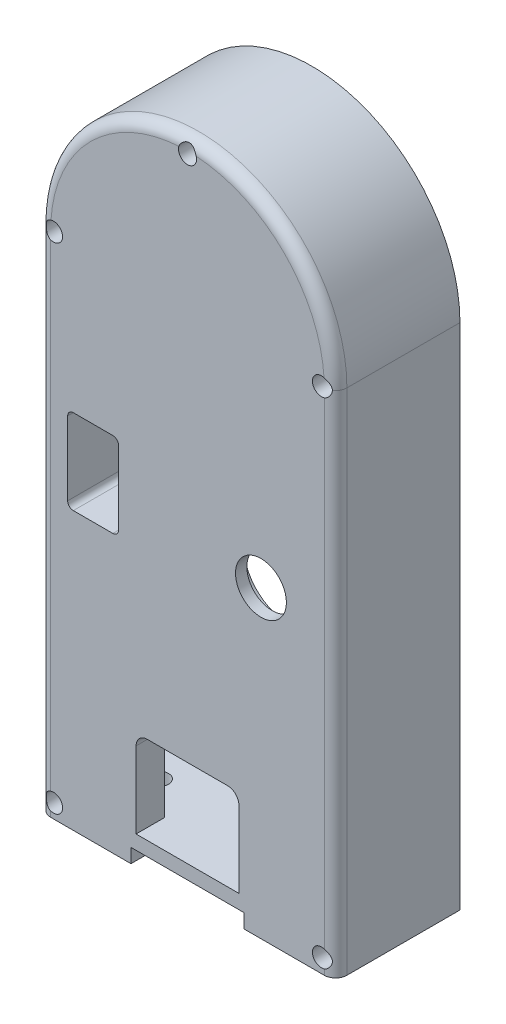
from build123d import *

# Parameters (mm, degrees)
SKETCH1_R               = 1.6
BOSS_EXTRUDE1_DEPTH     = 17
SKETCH2_R               = 1.65
CUT_EXTRUDE1_DEPTH      = 18
BOSS_EXTRUDE2_OUTLINE_R = 1.6
BOSS_EXTRUDE2_OUTLINE_W = 18.2
BOSS_EXTRUDE2_OUTLINE_H = 15.5
BOSS_EXTRUDE2_DEPTH     = 5
SKETCH5_R               = 8.1
CUT_EXTRUDE2_DEPTH      = 3
SKETCH6_R               = 4.5
CUT_EXTRUDE3_DEPTH      = 96.845918014
BOSS_EXTRUDE4_DEPTH     = 14
BOSS_EXTRUDE5_DEPTH     = 3
FILLET1_R               = 2
SKETCH10_W              = 9
SKETCH10_H              = 15
CUT_EXTRUDE4_DEPTH      = 5
FILLET2_R               = 1
FILLET3_R               = 1
FILLET4_R               = 2


# Read off the part's stored shape, not the designer's step: Boss-Extrude2
with BuildPart() as part:
    # Sketch1 → Boss-Extrude1 (new body)
    with BuildSketch(Plane.XY):
        with BuildLine():
            Line((10, -87.5), (10, -90))
            Line((10, -90), (26.2, -90))
            Line((26.2, -90), (26.2, 0))
            ThreePointArc((26.2, 0), (0, 26.2), (-26.2, 0))
            Line((-26.2, 0), (-26.2, -90))
            Line((-26.2, -90), (-10, -90))
            Line((-10, -90), (-10, -87.5))
            Line((-10, -87.5), (10, -87.5))
        make_face()
        with Locations((-23.7, -87.5)):
            Circle(SKETCH1_R, mode=Mode.SUBTRACT)
        with Locations((23.7, -87.5)):
            Circle(SKETCH1_R, mode=Mode.SUBTRACT)
        with Locations((-23.7, 0)):
            Circle(SKETCH1_R, mode=Mode.SUBTRACT)
        with Locations((0, 23.7)):
            Circle(SKETCH1_R, mode=Mode.SUBTRACT)
        with Locations((23.7, 0)):
            Circle(SKETCH1_R, mode=Mode.SUBTRACT)
        with BuildLine():
            Line((-21.2, -85), (21.2, -85))
            Line((21.2, -85), (21.2, 0))
            ThreePointArc((21.2, 0), (0, 21.2), (-21.2, 0))
            Line((-21.2, 0), (-21.2, -85))
        make_face(mode=Mode.SUBTRACT)
    extrude(amount=BOSS_EXTRUDE1_DEPTH)

    # Sketch2 → Cut-Extrude1 (cut)
    with BuildSketch(Plane.XZ.offset(90)):
        with Locations((15.5, 11.5)):
            Circle(SKETCH2_R)
        with Locations((-15.5, 11.5)):
            Circle(SKETCH2_R)
    extrude(amount=-CUT_EXTRUDE1_DEPTH, mode=Mode.SUBTRACT)

    # Boss-Extrude2 outline → Boss-Extrude2 (add)
    with BuildSketch(Plane.XY.offset(17)):
        with BuildLine():
            Line((-10, -87.5), (10, -87.5))
            Line((10, -87.5), (10, -90))
            Line((10, -90), (26.2, -90))
            Line((26.2, -90), (26.2, 0))
            ThreePointArc((26.2, 0), (0, 26.2), (-26.2, 0))
            Line((-26.2, 0), (-26.2, -90))
            Line((-26.2, -90), (-10, -90))
            Line((-10, -90), (-10, -87.5))
        make_face()
        with Locations((-23.7, -87.5)):
            Circle(BOSS_EXTRUDE2_OUTLINE_R, mode=Mode.SUBTRACT)
        with Locations((0, -77.25)):
            Rectangle(BOSS_EXTRUDE2_OUTLINE_W, BOSS_EXTRUDE2_OUTLINE_H, mode=Mode.SUBTRACT)
        with Locations((23.7, -87.5)):
            Circle(BOSS_EXTRUDE2_OUTLINE_R, mode=Mode.SUBTRACT)
        with Locations((-23.7, 0)):
            Circle(BOSS_EXTRUDE2_OUTLINE_R, mode=Mode.SUBTRACT)
        with Locations((0, 23.7)):
            Circle(BOSS_EXTRUDE2_OUTLINE_R, mode=Mode.SUBTRACT)
        with Locations((23.7, 0)):
            Circle(BOSS_EXTRUDE2_OUTLINE_R, mode=Mode.SUBTRACT)
    extrude(amount=BOSS_EXTRUDE2_DEPTH)

    # Sketch5 → Cut-Extrude2 (cut)
    with BuildSketch(Plane(origin=(0, 0, 17), x_dir=(-1, 0, 0), z_dir=(0, 0, -1))):
        with Locations((-12.995105527, -36.242762456)):
            Circle(SKETCH5_R)
    extrude(amount=-CUT_EXTRUDE2_DEPTH, mode=Mode.SUBTRACT)

    # Sketch6 → Cut-Extrude3 (cut, through all)
    with BuildSketch(Plane(origin=(0, 0, 20), x_dir=(-1, 0, 0), z_dir=(0, 0, -1))):
        with Locations((-12.995105527, -36.242762456)):
            Circle(SKETCH6_R)
    extrude(amount=-CUT_EXTRUDE3_DEPTH, mode=Mode.SUBTRACT)

    # Sketch7 → Boss-Extrude4 (add)
    with BuildSketch(Plane(origin=(0, 0, 17), x_dir=(-1, 0, 0), z_dir=(0, 0, -1))):
        with BuildLine():
            Line((21.2, -41), (13.2, -41))
            ThreePointArc((13.2, -41), (12.492893219, -40.707106781), (12.2, -40))
            Line((12.2, -40), (12.2, -20.899760764))
            ThreePointArc((12.2, -20.899760764), (10.968430418, -21.571590905), (9.7, -22.170926909))
            Line((9.7, -22.170926909), (9.7, -22.383029286))
            Line((9.7, -22.383029286), (9.7, -42.5))
            ThreePointArc((9.7, -42.5), (9.992893219, -43.207106781), (10.7, -43.5))
            Line((10.7, -43.5), (21.2, -43.5))
            Line((21.2, -43.5), (21.2, -41))
        make_face()
    extrude(amount=BOSS_EXTRUDE4_DEPTH)

    # Sketch8 → Boss-Extrude5 (add)
    with BuildSketch(Plane(origin=(0, 0, 3), x_dir=(-1, 0, 0), z_dir=(0, 0, -1))):
        with BuildLine():
            Line((12.2, -20.899760764), (21.2, -20.899760764))
            Line((21.2, -20.899760764), (21.2, -41))
            Line((21.2, -41), (21.2, -43.5))
            Line((21.2, -43.5), (10.7, -43.5))
            ThreePointArc((10.7, -43.5), (9.992893219, -43.207106781), (9.7, -42.5))
            Line((9.7, -42.5), (9.7, -22.170926909))
            ThreePointArc((9.7, -22.170926909), (10.968430418, -21.571590905), (12.2, -20.899760764))
        make_face()
    extrude(amount=BOSS_EXTRUDE5_DEPTH)

    # Fillet1
    # the kernel refuses this fillet: 2 mm, written as the material it takes off along each edge
    with BuildSketch(Plane(origin=(26.2, -95, 22), x_dir=(0, 0, -1), z_dir=(0, 1, 0)), Plane(origin=(-26.2, 0, 22), x_dir=(0, 0, -1), z_dir=(0, -1, 0))) as fillet1_piece_1:
        with BuildLine():
            CenterArc((FILLET1_R, FILLET1_R), FILLET1_R, 180, 90)
            Line((0, FILLET1_R), (0, 0))
            Line((0, 0), (FILLET1_R, 0))
        make_face()
    extrude(amount=95, mode=Mode.SUBTRACT)
    with BuildSketch(Plane(origin=(0, 0, 22), x_dir=(1, 0, 0), z_dir=(0, -1, 0))) as fillet1_piece_2:
        with BuildLine():
            CenterArc((26.2 - FILLET1_R, -FILLET1_R), FILLET1_R, 0, 90)
            Line((26.2, -FILLET1_R), (26.2, 0))
            Line((26.2, 0), (26.2 - FILLET1_R, 0))
        make_face()
    revolve(axis=Axis((0, 0, 22), (0, 0, 1)), revolution_arc=180, mode=Mode.SUBTRACT)

    # Sketch10 → Cut-Extrude4 (cut)
    with BuildSketch(Plane.XY.offset(22)):
        with Locations((-16.7, -33.5)):
            Rectangle(SKETCH10_W, SKETCH10_H)
    extrude(amount=-CUT_EXTRUDE4_DEPTH, mode=Mode.SUBTRACT)

    # Fillet2
    fillet2_edges = [part.edges().sort_by_distance(p)[0] for p in [
        (-21.2, -41, 12.5),
        (-12.2, -26, 19.5),
        (-21.2, -26, 19.5),
        (-12.2, -41, 19.5),
    ]]
    fillet(fillet2_edges, radius=FILLET2_R)

    # Fillet3
    fillet3_edges = [part.edges().sort_by_distance(p)[0] for p in [
        (-21.2, -43.5, 8.5),
        (-9.7, -32.335463454, 17),
        (-9.992893219, -43.207106781, 17),
        (-15.95, -43.5, 17),
        (-21.2, -20.899760764, 1.5),
    ]]
    fillet(fillet3_edges, radius=FILLET3_R)

    # Fillet4
    fillet4_edges = [part.edges().sort_by_distance(p)[0] for p in [
        (9.1, -69.5, 19.5),
        (-9.1, -69.5, 19.5),
    ]]
    fillet(fillet4_edges, radius=FILLET4_R)


solid = part.part
